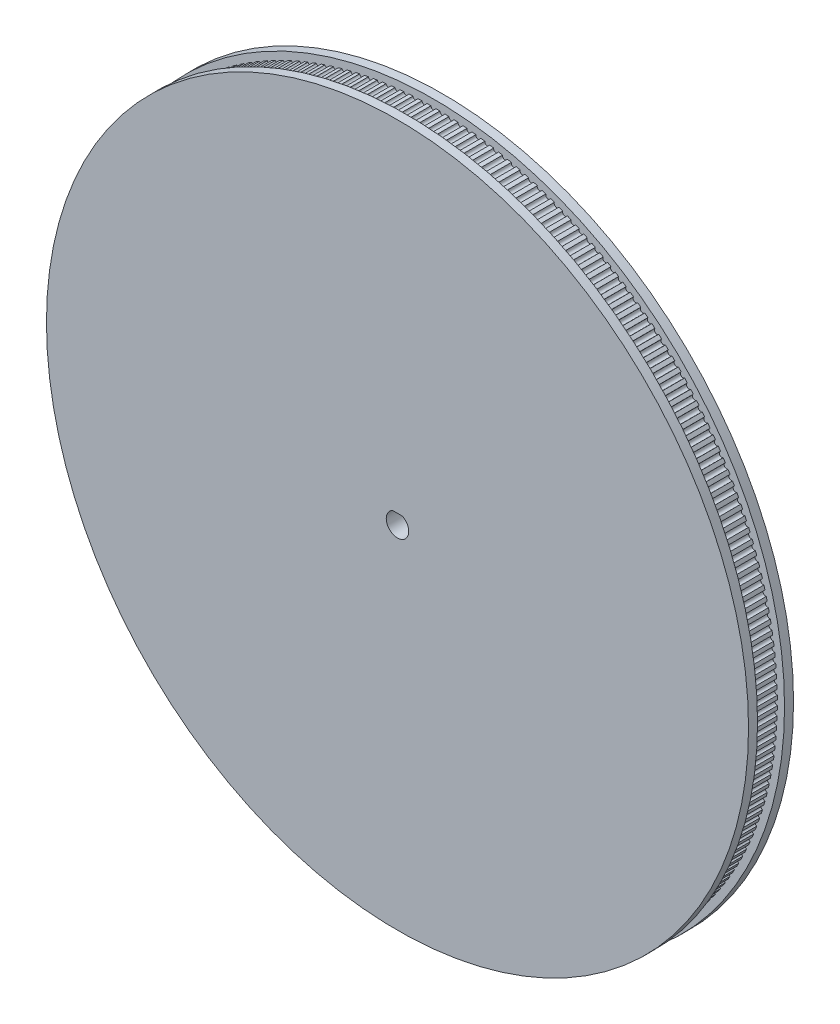
from build123d import *

# Parameters (mm, degrees)
SKIZZE2_R                       = 76.395
AUFSATZ_LINEAR_AUSTRAGEN1_DEPTH = 6
SKIZZE3_R                       = 0.56
SCHNITT_LINEAR_AUSTRAGEN3_DEPTH = 109.205323575
SKIZZE4_R                       = 78
AUFSATZ_LINEAR_AUSTRAGEN2_DEPTH = 2
AUFSATZ_LINEAR_START            = 2
SKIZZE5_R                       = 78
AUFSATZ_LINEAR_AUSTRAGEN3_DEPTH = 2
SCHNITT_LINEAR_AUSTRAGEN4_DEPTH = 111.761003968


with BuildPart() as part:
    # Skizze2 → Aufsatz-Linear austragen1 (new body)
    with BuildSketch(Plane.XY):
        Circle(SKIZZE2_R)
    extrude(amount=AUFSATZ_LINEAR_AUSTRAGEN1_DEPTH)

    # Skizze3 → Schnitt-Linear austragen3 (cut, through all)
    with BuildSketch(Plane.XY.offset(6)):
        with Locations((0, 76.395)):
            Circle(SKIZZE3_R)
        with Locations((1.999787966, 76.368821342)):
            Circle(SKIZZE3_R)
        with Locations((3.998205377, 76.290303308)):
            Circle(SKIZZE3_R)
        with Locations((5.993882618, 76.159499711)):
            Circle(SKIZZE3_R)
        with Locations((7.985451951, 75.976500197)):
            Circle(SKIZZE3_R)
        with Locations((9.971548455, 75.741430185)):
            Circle(SKIZZE3_R)
        with Locations((11.950810957, 75.45445078)):
            Circle(SKIZZE3_R)
        with Locations((13.92188297, 75.115758663)):
            Circle(SKIZZE3_R)
        with Locations((15.88341362, 74.725585958)):
            Circle(SKIZZE3_R)
        with Locations((17.834058572, 74.284200069)):
            Circle(SKIZZE3_R)
        with Locations((19.772480951, 73.791903499)):
            Circle(SKIZZE3_R)
        with Locations((21.697352259, 73.249033645)):
            Circle(SKIZZE3_R)
        with Locations((23.607353285, 72.655962562)):
            Circle(SKIZZE3_R)
        with Locations((25.501175011, 72.013096712)):
            Circle(SKIZZE3_R)
        with Locations((27.377519506, 71.320876682)):
            Circle(SKIZZE3_R)
        with Locations((29.235100816, 70.579776886)):
            Circle(SKIZZE3_R)
        with Locations((31.072645848, 69.790305237)):
            Circle(SKIZZE3_R)
        with Locations((32.888895241, 68.953002798)):
            Circle(SKIZZE3_R)
        with Locations((34.682604228, 68.068443415)):
            Circle(SKIZZE3_R)
        with Locations((36.45254349, 67.137233322)):
            Circle(SKIZZE3_R)
        with Locations((38.1975, 66.160010722)):
            Circle(SKIZZE3_R)
        with Locations((39.916277851, 65.137445356)):
            Circle(SKIZZE3_R)
        with Locations((41.60769908, 64.070238038)):
            Circle(SKIZZE3_R)
        with Locations((43.27060447, 62.95912018)):
            Circle(SKIZZE3_R)
        with Locations((44.903854349, 61.804853285)):
            Circle(SKIZZE3_R)
        with Locations((46.506329369, 60.608228432)):
            Circle(SKIZZE3_R)
        with Locations((48.076931274, 59.370065726)):
            Circle(SKIZZE3_R)
        with Locations((49.614583652, 58.091213742)):
            Circle(SKIZZE3_R)
        with Locations((51.118232673, 56.772548942)):
            Circle(SKIZZE3_R)
        with Locations((52.58684781, 55.414975073)):
            Circle(SKIZZE3_R)
        with Locations((54.019422549, 54.019422549)):
            Circle(SKIZZE3_R)
        with Locations((55.414975073, 52.58684781)):
            Circle(SKIZZE3_R)
        with Locations((56.772548942, 51.118232673)):
            Circle(SKIZZE3_R)
        with Locations((58.091213742, 49.614583652)):
            Circle(SKIZZE3_R)
        with Locations((59.370065726, 48.076931274)):
            Circle(SKIZZE3_R)
        with Locations((60.608228432, 46.506329369)):
            Circle(SKIZZE3_R)
        with Locations((61.804853285, 44.903854349)):
            Circle(SKIZZE3_R)
        with Locations((62.95912018, 43.27060447)):
            Circle(SKIZZE3_R)
        with Locations((64.070238038, 41.60769908)):
            Circle(SKIZZE3_R)
        with Locations((65.137445356, 39.916277851)):
            Circle(SKIZZE3_R)
        with Locations((66.160010722, 38.1975)):
            Circle(SKIZZE3_R)
        with Locations((67.137233322, 36.45254349)):
            Circle(SKIZZE3_R)
        with Locations((68.068443415, 34.682604228)):
            Circle(SKIZZE3_R)
        with Locations((68.953002798, 32.888895241)):
            Circle(SKIZZE3_R)
        with Locations((69.790305237, 31.072645848)):
            Circle(SKIZZE3_R)
        with Locations((70.579776886, 29.235100816)):
            Circle(SKIZZE3_R)
        with Locations((71.320876682, 27.377519506)):
            Circle(SKIZZE3_R)
        with Locations((72.013096712, 25.501175011)):
            Circle(SKIZZE3_R)
        with Locations((72.655962562, 23.607353285)):
            Circle(SKIZZE3_R)
        with Locations((73.249033645, 21.697352259)):
            Circle(SKIZZE3_R)
        with Locations((73.791903499, 19.772480951)):
            Circle(SKIZZE3_R)
        with Locations((74.284200069, 17.834058572)):
            Circle(SKIZZE3_R)
        with Locations((74.725585958, 15.88341362)):
            Circle(SKIZZE3_R)
        with Locations((75.115758663, 13.92188297)):
            Circle(SKIZZE3_R)
        with Locations((75.45445078, 11.950810957)):
            Circle(SKIZZE3_R)
        with Locations((75.741430185, 9.971548455)):
            Circle(SKIZZE3_R)
        with Locations((75.976500197, 7.985451951)):
            Circle(SKIZZE3_R)
        with Locations((76.159499711, 5.993882618)):
            Circle(SKIZZE3_R)
        with Locations((76.290303308, 3.998205377)):
            Circle(SKIZZE3_R)
        with Locations((76.368821342, 1.999787966)):
            Circle(SKIZZE3_R)
        with Locations((76.395, 0)):
            Circle(SKIZZE3_R)
        with Locations((76.368821342, -1.999787966)):
            Circle(SKIZZE3_R)
        with Locations((76.290303308, -3.998205377)):
            Circle(SKIZZE3_R)
        with Locations((76.159499711, -5.993882618)):
            Circle(SKIZZE3_R)
        with Locations((75.976500197, -7.985451951)):
            Circle(SKIZZE3_R)
        with Locations((75.741430185, -9.971548455)):
            Circle(SKIZZE3_R)
        with Locations((75.45445078, -11.950810957)):
            Circle(SKIZZE3_R)
        with Locations((75.115758663, -13.92188297)):
            Circle(SKIZZE3_R)
        with Locations((74.725585958, -15.88341362)):
            Circle(SKIZZE3_R)
        with Locations((74.284200069, -17.834058572)):
            Circle(SKIZZE3_R)
        with Locations((73.791903499, -19.772480951)):
            Circle(SKIZZE3_R)
        with Locations((73.249033645, -21.697352259)):
            Circle(SKIZZE3_R)
        with Locations((72.655962562, -23.607353285)):
            Circle(SKIZZE3_R)
        with Locations((72.013096712, -25.501175011)):
            Circle(SKIZZE3_R)
        with Locations((71.320876682, -27.377519506)):
            Circle(SKIZZE3_R)
        with Locations((70.579776886, -29.235100816)):
            Circle(SKIZZE3_R)
        with Locations((69.790305237, -31.072645848)):
            Circle(SKIZZE3_R)
        with Locations((68.953002798, -32.888895241)):
            Circle(SKIZZE3_R)
        with Locations((68.068443415, -34.682604228)):
            Circle(SKIZZE3_R)
        with Locations((67.137233322, -36.45254349)):
            Circle(SKIZZE3_R)
        with Locations((66.160010722, -38.1975)):
            Circle(SKIZZE3_R)
        with Locations((65.137445356, -39.916277851)):
            Circle(SKIZZE3_R)
        with Locations((64.070238038, -41.60769908)):
            Circle(SKIZZE3_R)
        with Locations((62.95912018, -43.27060447)):
            Circle(SKIZZE3_R)
        with Locations((61.804853285, -44.903854349)):
            Circle(SKIZZE3_R)
        with Locations((60.608228432, -46.506329369)):
            Circle(SKIZZE3_R)
        with Locations((59.370065726, -48.076931274)):
            Circle(SKIZZE3_R)
        with Locations((58.091213742, -49.614583652)):
            Circle(SKIZZE3_R)
        with Locations((56.772548942, -51.118232673)):
            Circle(SKIZZE3_R)
        with Locations((55.414975073, -52.58684781)):
            Circle(SKIZZE3_R)
        with Locations((54.019422549, -54.019422549)):
            Circle(SKIZZE3_R)
        with Locations((52.58684781, -55.414975073)):
            Circle(SKIZZE3_R)
        with Locations((51.118232673, -56.772548942)):
            Circle(SKIZZE3_R)
        with Locations((49.614583652, -58.091213742)):
            Circle(SKIZZE3_R)
        with Locations((48.076931274, -59.370065726)):
            Circle(SKIZZE3_R)
        with Locations((46.506329369, -60.608228432)):
            Circle(SKIZZE3_R)
        with Locations((44.903854349, -61.804853285)):
            Circle(SKIZZE3_R)
        with Locations((43.27060447, -62.95912018)):
            Circle(SKIZZE3_R)
        with Locations((41.60769908, -64.070238038)):
            Circle(SKIZZE3_R)
        with Locations((39.916277851, -65.137445356)):
            Circle(SKIZZE3_R)
        with Locations((38.1975, -66.160010722)):
            Circle(SKIZZE3_R)
        with Locations((36.45254349, -67.137233322)):
            Circle(SKIZZE3_R)
        with Locations((34.682604228, -68.068443415)):
            Circle(SKIZZE3_R)
        with Locations((32.888895241, -68.953002798)):
            Circle(SKIZZE3_R)
        with Locations((31.072645848, -69.790305237)):
            Circle(SKIZZE3_R)
        with Locations((29.235100816, -70.579776886)):
            Circle(SKIZZE3_R)
        with Locations((27.377519506, -71.320876682)):
            Circle(SKIZZE3_R)
        with Locations((25.501175011, -72.013096712)):
            Circle(SKIZZE3_R)
        with Locations((23.607353285, -72.655962562)):
            Circle(SKIZZE3_R)
        with Locations((21.697352259, -73.249033645)):
            Circle(SKIZZE3_R)
        with Locations((19.772480951, -73.791903499)):
            Circle(SKIZZE3_R)
        with Locations((17.834058572, -74.284200069)):
            Circle(SKIZZE3_R)
        with Locations((15.88341362, -74.725585958)):
            Circle(SKIZZE3_R)
        with Locations((13.92188297, -75.115758663)):
            Circle(SKIZZE3_R)
        with Locations((11.950810957, -75.45445078)):
            Circle(SKIZZE3_R)
        with Locations((9.971548455, -75.741430185)):
            Circle(SKIZZE3_R)
        with Locations((7.985451951, -75.976500197)):
            Circle(SKIZZE3_R)
        with Locations((5.993882618, -76.159499711)):
            Circle(SKIZZE3_R)
        with Locations((3.998205377, -76.290303308)):
            Circle(SKIZZE3_R)
        with Locations((1.999787966, -76.368821342)):
            Circle(SKIZZE3_R)
        with Locations((0, -76.395)):
            Circle(SKIZZE3_R)
        with Locations((-1.999787966, -76.368821342)):
            Circle(SKIZZE3_R)
        with Locations((-3.998205377, -76.290303308)):
            Circle(SKIZZE3_R)
        with Locations((-5.993882618, -76.159499711)):
            Circle(SKIZZE3_R)
        with Locations((-7.985451951, -75.976500197)):
            Circle(SKIZZE3_R)
        with Locations((-9.971548455, -75.741430185)):
            Circle(SKIZZE3_R)
        with Locations((-11.950810957, -75.45445078)):
            Circle(SKIZZE3_R)
        with Locations((-13.92188297, -75.115758663)):
            Circle(SKIZZE3_R)
        with Locations((-15.88341362, -74.725585958)):
            Circle(SKIZZE3_R)
        with Locations((-17.834058572, -74.284200069)):
            Circle(SKIZZE3_R)
        with Locations((-19.772480951, -73.791903499)):
            Circle(SKIZZE3_R)
        with Locations((-21.697352259, -73.249033645)):
            Circle(SKIZZE3_R)
        with Locations((-23.607353285, -72.655962562)):
            Circle(SKIZZE3_R)
        with Locations((-25.501175011, -72.013096712)):
            Circle(SKIZZE3_R)
        with Locations((-27.377519506, -71.320876682)):
            Circle(SKIZZE3_R)
        with Locations((-29.235100816, -70.579776886)):
            Circle(SKIZZE3_R)
        with Locations((-31.072645848, -69.790305237)):
            Circle(SKIZZE3_R)
        with Locations((-32.888895241, -68.953002798)):
            Circle(SKIZZE3_R)
        with Locations((-34.682604228, -68.068443415)):
            Circle(SKIZZE3_R)
        with Locations((-36.45254349, -67.137233322)):
            Circle(SKIZZE3_R)
        with Locations((-38.1975, -66.160010722)):
            Circle(SKIZZE3_R)
        with Locations((-39.916277851, -65.137445356)):
            Circle(SKIZZE3_R)
        with Locations((-41.60769908, -64.070238038)):
            Circle(SKIZZE3_R)
        with Locations((-43.27060447, -62.95912018)):
            Circle(SKIZZE3_R)
        with Locations((-44.903854349, -61.804853285)):
            Circle(SKIZZE3_R)
        with Locations((-46.506329369, -60.608228432)):
            Circle(SKIZZE3_R)
        with Locations((-48.076931274, -59.370065726)):
            Circle(SKIZZE3_R)
        with Locations((-49.614583652, -58.091213742)):
            Circle(SKIZZE3_R)
        with Locations((-51.118232673, -56.772548942)):
            Circle(SKIZZE3_R)
        with Locations((-52.58684781, -55.414975073)):
            Circle(SKIZZE3_R)
        with Locations((-54.019422549, -54.019422549)):
            Circle(SKIZZE3_R)
        with Locations((-55.414975073, -52.58684781)):
            Circle(SKIZZE3_R)
        with Locations((-56.772548942, -51.118232673)):
            Circle(SKIZZE3_R)
        with Locations((-58.091213742, -49.614583652)):
            Circle(SKIZZE3_R)
        with Locations((-59.370065725, -48.076931274)):
            Circle(SKIZZE3_R)
        with Locations((-60.608228432, -46.506329369)):
            Circle(SKIZZE3_R)
        with Locations((-61.804853285, -44.903854349)):
            Circle(SKIZZE3_R)
        with Locations((-62.95912018, -43.27060447)):
            Circle(SKIZZE3_R)
        with Locations((-64.070238038, -41.60769908)):
            Circle(SKIZZE3_R)
        with Locations((-65.137445356, -39.916277851)):
            Circle(SKIZZE3_R)
        with Locations((-66.160010722, -38.1975)):
            Circle(SKIZZE3_R)
        with Locations((-67.137233322, -36.45254349)):
            Circle(SKIZZE3_R)
        with Locations((-68.068443415, -34.682604228)):
            Circle(SKIZZE3_R)
        with Locations((-68.953002798, -32.888895241)):
            Circle(SKIZZE3_R)
        with Locations((-69.790305237, -31.072645848)):
            Circle(SKIZZE3_R)
        with Locations((-70.579776886, -29.235100816)):
            Circle(SKIZZE3_R)
        with Locations((-71.320876682, -27.377519506)):
            Circle(SKIZZE3_R)
        with Locations((-72.013096712, -25.501175011)):
            Circle(SKIZZE3_R)
        with Locations((-72.655962562, -23.607353285)):
            Circle(SKIZZE3_R)
        with Locations((-73.249033645, -21.697352259)):
            Circle(SKIZZE3_R)
        with Locations((-73.791903499, -19.772480951)):
            Circle(SKIZZE3_R)
        with Locations((-74.284200069, -17.834058572)):
            Circle(SKIZZE3_R)
        with Locations((-74.725585958, -15.88341362)):
            Circle(SKIZZE3_R)
        with Locations((-75.115758663, -13.92188297)):
            Circle(SKIZZE3_R)
        with Locations((-75.45445078, -11.950810957)):
            Circle(SKIZZE3_R)
        with Locations((-75.741430185, -9.971548455)):
            Circle(SKIZZE3_R)
        with Locations((-75.976500197, -7.985451951)):
            Circle(SKIZZE3_R)
        with Locations((-76.159499711, -5.993882618)):
            Circle(SKIZZE3_R)
        with Locations((-76.290303308, -3.998205377)):
            Circle(SKIZZE3_R)
        with Locations((-76.368821342, -1.999787966)):
            Circle(SKIZZE3_R)
        with Locations((-76.395, 0)):
            Circle(SKIZZE3_R)
        with Locations((-76.368821342, 1.999787966)):
            Circle(SKIZZE3_R)
        with Locations((-76.290303308, 3.998205377)):
            Circle(SKIZZE3_R)
        with Locations((-76.159499711, 5.993882618)):
            Circle(SKIZZE3_R)
        with Locations((-75.976500197, 7.985451951)):
            Circle(SKIZZE3_R)
        with Locations((-75.741430185, 9.971548455)):
            Circle(SKIZZE3_R)
        with Locations((-75.45445078, 11.950810957)):
            Circle(SKIZZE3_R)
        with Locations((-75.115758663, 13.92188297)):
            Circle(SKIZZE3_R)
        with Locations((-74.725585958, 15.88341362)):
            Circle(SKIZZE3_R)
        with Locations((-74.284200069, 17.834058572)):
            Circle(SKIZZE3_R)
        with Locations((-73.791903499, 19.772480951)):
            Circle(SKIZZE3_R)
        with Locations((-73.249033645, 21.697352259)):
            Circle(SKIZZE3_R)
        with Locations((-72.655962562, 23.607353285)):
            Circle(SKIZZE3_R)
        with Locations((-72.013096712, 25.501175011)):
            Circle(SKIZZE3_R)
        with Locations((-71.320876682, 27.377519506)):
            Circle(SKIZZE3_R)
        with Locations((-70.579776886, 29.235100816)):
            Circle(SKIZZE3_R)
        with Locations((-69.790305237, 31.072645848)):
            Circle(SKIZZE3_R)
        with Locations((-68.953002798, 32.888895241)):
            Circle(SKIZZE3_R)
        with Locations((-68.068443415, 34.682604228)):
            Circle(SKIZZE3_R)
        with Locations((-67.137233322, 36.45254349)):
            Circle(SKIZZE3_R)
        with Locations((-66.160010722, 38.1975)):
            Circle(SKIZZE3_R)
        with Locations((-65.137445356, 39.916277851)):
            Circle(SKIZZE3_R)
        with Locations((-64.070238038, 41.60769908)):
            Circle(SKIZZE3_R)
        with Locations((-62.95912018, 43.27060447)):
            Circle(SKIZZE3_R)
        with Locations((-61.804853285, 44.903854349)):
            Circle(SKIZZE3_R)
        with Locations((-60.608228432, 46.506329369)):
            Circle(SKIZZE3_R)
        with Locations((-59.370065726, 48.076931274)):
            Circle(SKIZZE3_R)
        with Locations((-58.091213742, 49.614583652)):
            Circle(SKIZZE3_R)
        with Locations((-56.772548942, 51.118232673)):
            Circle(SKIZZE3_R)
        with Locations((-55.414975073, 52.58684781)):
            Circle(SKIZZE3_R)
        with Locations((-54.019422549, 54.019422549)):
            Circle(SKIZZE3_R)
        with Locations((-52.58684781, 55.414975073)):
            Circle(SKIZZE3_R)
        with Locations((-51.118232673, 56.772548942)):
            Circle(SKIZZE3_R)
        with Locations((-49.614583652, 58.091213742)):
            Circle(SKIZZE3_R)
        with Locations((-48.076931274, 59.370065726)):
            Circle(SKIZZE3_R)
        with Locations((-46.506329369, 60.608228432)):
            Circle(SKIZZE3_R)
        with Locations((-44.903854349, 61.804853285)):
            Circle(SKIZZE3_R)
        with Locations((-43.27060447, 62.95912018)):
            Circle(SKIZZE3_R)
        with Locations((-41.60769908, 64.070238038)):
            Circle(SKIZZE3_R)
        with Locations((-39.916277851, 65.137445356)):
            Circle(SKIZZE3_R)
        with Locations((-38.1975, 66.160010722)):
            Circle(SKIZZE3_R)
        with Locations((-36.45254349, 67.137233322)):
            Circle(SKIZZE3_R)
        with Locations((-34.682604228, 68.068443415)):
            Circle(SKIZZE3_R)
        with Locations((-32.888895241, 68.953002798)):
            Circle(SKIZZE3_R)
        with Locations((-31.072645848, 69.790305237)):
            Circle(SKIZZE3_R)
        with Locations((-29.235100816, 70.579776886)):
            Circle(SKIZZE3_R)
        with Locations((-27.377519506, 71.320876682)):
            Circle(SKIZZE3_R)
        with Locations((-25.501175011, 72.013096712)):
            Circle(SKIZZE3_R)
        with Locations((-23.607353285, 72.655962562)):
            Circle(SKIZZE3_R)
        with Locations((-21.697352259, 73.249033645)):
            Circle(SKIZZE3_R)
        with Locations((-19.772480951, 73.791903499)):
            Circle(SKIZZE3_R)
        with Locations((-17.834058572, 74.284200069)):
            Circle(SKIZZE3_R)
        with Locations((-15.88341362, 74.725585958)):
            Circle(SKIZZE3_R)
        with Locations((-13.92188297, 75.115758663)):
            Circle(SKIZZE3_R)
        with Locations((-11.950810957, 75.45445078)):
            Circle(SKIZZE3_R)
        with Locations((-9.971548455, 75.741430185)):
            Circle(SKIZZE3_R)
        with Locations((-7.985451951, 75.976500197)):
            Circle(SKIZZE3_R)
        with Locations((-5.993882618, 76.159499711)):
            Circle(SKIZZE3_R)
        with Locations((-3.998205377, 76.290303308)):
            Circle(SKIZZE3_R)
        with Locations((-1.999787966, 76.368821342)):
            Circle(SKIZZE3_R)
    extrude(amount=-SCHNITT_LINEAR_AUSTRAGEN3_DEPTH, mode=Mode.SUBTRACT)

    # Skizze4 → Aufsatz-Linear austragen2 (add)
    with BuildSketch(Plane(origin=(0, 0, 0), x_dir=(-1, 0, 0), z_dir=(0, 0, -1))):
        Circle(SKIZZE4_R)
    extrude(amount=AUFSATZ_LINEAR_AUSTRAGEN2_DEPTH)

    # Skizze5 → Aufsatz-Linear austragen3 (add)
    with BuildSketch(Plane.XY.offset(6).offset(AUFSATZ_LINEAR_START)):
        Circle(SKIZZE5_R)
    extrude(amount=-AUFSATZ_LINEAR_AUSTRAGEN3_DEPTH)

    # Skizze6 → Schnitt-Linear austragen4 (cut, through all)
    with BuildSketch(Plane.XY.offset(8)):
        with BuildLine():
            Line((-1.089724736, 2.25), (1.089724736, 2.25))
            ThreePointArc((1.089724736, 2.25), (0, -2.5), (-1.089724736, 2.25))
        make_face()
    extrude(amount=-SCHNITT_LINEAR_AUSTRAGEN4_DEPTH, mode=Mode.SUBTRACT)


solid = part.part
